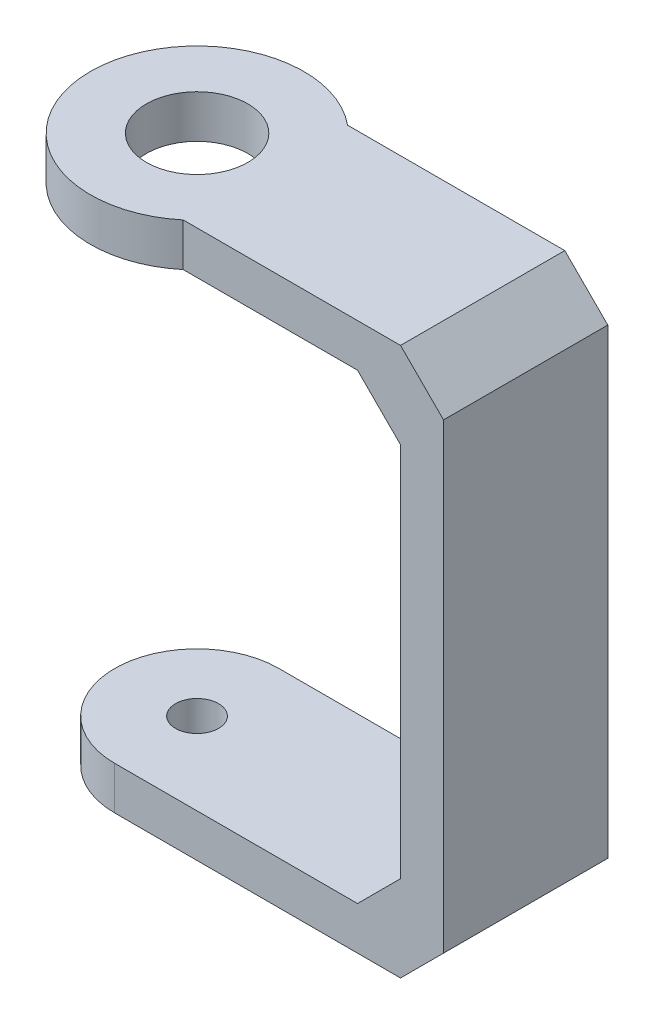
from build123d import *
from OCP.BRepAlgoAPI import BRepAlgoAPI_Cut
from OCP.TopTools import TopTools_ListOfShape

# Parameters (mm, degrees)
BOSS_EXTRUDE1_DEPTH      = 5.73
BOSS_EXTRUDE1_DEPTH_BACK = 5.73
BOSS_EXTRUDE5_DEPTH      = 11.46
BOSS_EXTRUDE8_DEPTH      = 11.46
BOSS_EXTRUDE9_DEPTH      = 3
SKETCH11_R               = 3.54
CUT_EXTRUDE1_DEPTH       = 3
BOSS_EXTRUDE10_DEPTH     = 3
SKETCH13_R               = 1.5
CUT_EXTRUDE2_DEPTH       = 3


with BuildPart() as part:
    # Sketch1 → Boss-Extrude1 (new, two sides: drawn at the far end of the back side and taken through both)
    with BuildSketch(Plane.XY.offset(-BOSS_EXTRUDE1_DEPTH_BACK)):
        Polygon((23.736099909, 38.996836219), (26.736100401, 35.996833865), (26.736100401, 3.776835326), (23.736098978, 0.776835766), (20.736098486, 3.77683812), (23.736098978, 6.776836749), (23.736098978, 32.99683803), (20.736100349, 35.996838521), align=None)
    extrude(amount=BOSS_EXTRUDE1_DEPTH + BOSS_EXTRUDE1_DEPTH_BACK)

    # Sketch6 → Boss-Extrude5 (add)
    with BuildSketch(Plane.XY.offset(5.73)):
        Polygon((20.736098486, 3.77683812), (8.576098486, 3.77683812), (8.576098486, 0.776835766), (20.736098486, 0.776835766), (23.736098978, 0.776835766), align=None)
    extrude(amount=-BOSS_EXTRUDE5_DEPTH)

    # Sketch8 → Boss-Extrude8 (add)
    with BuildSketch(Plane.XY.offset(5.73)):
        Polygon((20.736100349, 38.996836219), (23.736099909, 38.996836219), (20.736100349, 35.996838521), (8.576100349, 35.996838521), (8.576100349, 38.996836219), align=None)
    extrude(amount=-BOSS_EXTRUDE8_DEPTH)

    # Sketch9 → Boss-Extrude9 (add)
    with BuildSketch(Plane(origin=(0, 38.996836219, 0), x_dir=(1, 0, 0), z_dir=(0, 1, 0))):
        with BuildLine():
            Line((8.576100349, 5.73), (8.576100349, -5.73))
            ThreePointArc((8.576100349, -5.73), (-3.635159989, 0), (8.576100349, 5.73))
        make_face()
    extrude(amount=-BOSS_EXTRUDE9_DEPTH)

    # Sketch11 → Cut-Extrude1 (cut)
    with BuildSketch(Plane(origin=(0, 38.996836219, 0), x_dir=(1, 0, 0), z_dir=(0, 1, 0))):
        with Locations((3.814840011, 0)):
            Circle(SKETCH11_R)
    extrude(amount=-CUT_EXTRUDE1_DEPTH, mode=Mode.SUBTRACT)

    # Sketch12 → Boss-Extrude10 (add)
    with BuildSketch(Plane(origin=(0, 0.776835766, 0), x_dir=(-1, 0, 0), z_dir=(0, -1, 0))):
        with BuildLine():
            Line((-8.576098486, 5.73), (-3.793078174, 5.73))
            ThreePointArc((-3.793078174, 5.73), (1.936921826, 0), (-3.793078174, -5.73))
            Line((-3.793078174, -5.73), (-8.576098486, -5.73))
            Line((-8.576098486, -5.73), (-8.576098486, 5.73))
        make_face()
    extrude(amount=-BOSS_EXTRUDE10_DEPTH)


with BuildPart() as cut_extrude2_tool:
    # Sketch13 → Cut-Extrude2 (new body)
    with BuildSketch(Plane(origin=(0, 3.77683812, 0), x_dir=(1, 0, 0), z_dir=(0, 1, 0))):
        with Locations((3.81, 0)):
            Circle(SKETCH13_R)
    extrude(amount=-CUT_EXTRUDE2_DEPTH)


with BuildPart() as part_1:
    add(part.part)

    # Cut-Extrude2: cut by cut_extrude2_tool, with a tolerance
    cut_extrude2_stock = TopTools_ListOfShape()
    cut_extrude2_stock.Append(part_1.part.wrapped)
    cut_extrude2_tools = TopTools_ListOfShape()
    cut_extrude2_tools.Append(cut_extrude2_tool.part.wrapped)
    cut_extrude2_cut = BRepAlgoAPI_Cut()
    cut_extrude2_cut.SetArguments(cut_extrude2_stock)
    cut_extrude2_cut.SetTools(cut_extrude2_tools)
    cut_extrude2_cut.SetFuzzyValue(0.00001)
    cut_extrude2_cut.Build()
    add(Compound.cast(cut_extrude2_cut.Shape()).solids(), mode=Mode.REPLACE)


solid = part_1.part
